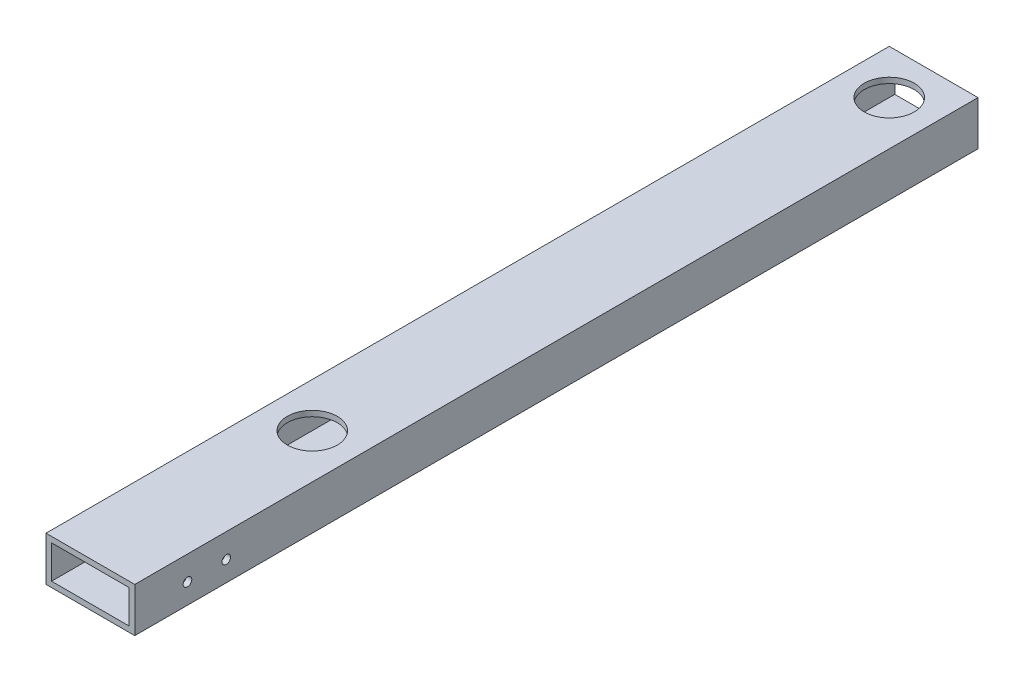
from build123d import *

# Parameters (mm, degrees)
SKETCH1_W                    = 50.8
SKETCH1_H                    = 25.4
BOSS_EXTRUDE1_DEPTH          = 241.3
SKETCH2_W                    = 44.45
SKETCH2_H                    = 19.05
CUT_EXTRUDE1_DEPTH           = 484.434804291
SKETCH5_R                    = 14.2875
CUT_EXTRUDE2_DEPTH           = 508
SKETCH7_R                    = 14.2875
CUT_EXTRUDE4_DEPTH           = 244.959033446
F_10_0_1935_DIAMETER_HOLE1_D = 4.9149


with BuildPart() as part:
    # Sketch1 → Boss-Extrude1 (new, symmetric)
    with BuildSketch(Plane.XY):
        Rectangle(SKETCH1_W, SKETCH1_H)
    extrude(amount=BOSS_EXTRUDE1_DEPTH, both=True)

    # Sketch2 → Cut-Extrude1 (cut, through all)
    with BuildSketch(Plane.XY.offset(241.3)):
        Rectangle(SKETCH2_W, SKETCH2_H)
    extrude(amount=-CUT_EXTRUDE1_DEPTH, mode=Mode.SUBTRACT)

    # Sketch5 → Cut-Extrude2 (cut)
    with BuildSketch(Plane(origin=(0, 12.7, 0), x_dir=(1, 0, 0), z_dir=(0, 1, 0))):
        with Locations((0, 215.9)):
            Circle(SKETCH5_R)
    extrude(amount=-CUT_EXTRUDE2_DEPTH, mode=Mode.SUBTRACT)

    # Sketch7 → Cut-Extrude4 (cut, through all)
    with BuildSketch(Plane(origin=(0, 12.7, 0), x_dir=(1, 0, 0), z_dir=(0, 1, 0))):
        with Locations((0, -114.3)):
            Circle(SKETCH7_R)
    extrude(amount=-CUT_EXTRUDE4_DEPTH, mode=Mode.SUBTRACT)

    # #10 (0.1935) Diameter Hole1 (through all)
    with Locations(Plane.ZY.offset(25.4)):
        with Locations((188.9125, -1.143), (211.1375, -1.143)):
            Hole(F_10_0_1935_DIAMETER_HOLE1_D / 2)


solid = part.part
